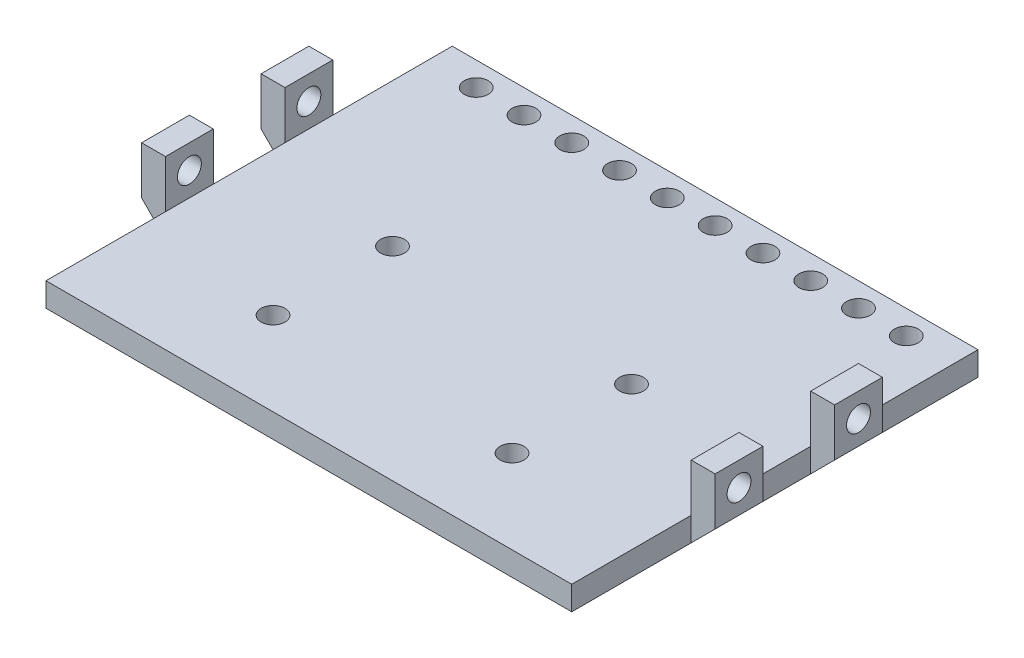
from build123d import *

# Parameters (mm, degrees)
SKETCH1_W           = 120
SKETCH1_H           = 85
BOSS_EXTRUDE1_DEPTH = 5
SKETCH2_W           = 5
SKETCH2_H           = 10
BOSS_EXTRUDE2_DEPTH = 10
SKETCH3_R           = 2.5
CUT_EXTRUDE1_DEPTH  = 129.184437433
SKETCH5_W           = 5
SKETCH5_H           = 25
SKETCH5_H_2         = 15
CUT_EXTRUDE2_DEPTH  = 75.204110398
CHAMFER1_SIZE       = 5
SKETCH6_R           = 2.5
CUT_EXTRUDE3_DEPTH  = 76.041655099
SKETCH7_R           = 2.5
CUT_EXTRUDE4_DEPTH  = 10


with BuildPart() as part:
    # Sketch1 → Boss-Extrude1 (new body)
    with BuildSketch(Plane(origin=(0, 0, 0), x_dir=(1, 0, 0), z_dir=(0, 1, 0))):
        Rectangle(SKETCH1_W, SKETCH1_H)
    extrude(amount=BOSS_EXTRUDE1_DEPTH)

    # Sketch2 → Boss-Extrude2 (add)
    with BuildSketch(Plane(origin=(0, 5, 0), x_dir=(1, 0, 0), z_dir=(0, 1, 0))):
        with Locations((-57.5, 12.5)):
            Rectangle(SKETCH2_W, SKETCH2_H)
        with Locations((-57.5, -12.5)):
            Rectangle(SKETCH2_W, SKETCH2_H)
        with Locations((57.5, -12.5)):
            Rectangle(SKETCH2_W, SKETCH2_H)
        with Locations((57.5, 12.5)):
            Rectangle(SKETCH2_W, SKETCH2_H)
    extrude(amount=BOSS_EXTRUDE2_DEPTH)

    # Sketch3 → Cut-Extrude1 (cut, through all)
    with BuildSketch(Plane.ZY.offset(60)):
        with Locations((-12.5, 10)):
            Circle(SKETCH3_R)
        with Locations((12.5, 10)):
            Circle(SKETCH3_R)
    extrude(amount=-CUT_EXTRUDE1_DEPTH, mode=Mode.SUBTRACT)

    # Sketch5 → Cut-Extrude2 (cut, through all)
    with BuildSketch(Plane(origin=(0, 5, 0), x_dir=(1, 0, 0), z_dir=(0, 1, 0))):
        with Locations((-57.5, 30)):
            Rectangle(SKETCH5_W, SKETCH5_H)
        with Locations((-57.5, 0)):
            Rectangle(SKETCH5_W, SKETCH5_H_2)
        with Locations((-57.5, -30)):
            Rectangle(SKETCH5_W, SKETCH5_H)
        with Locations((57.5, -30)):
            Rectangle(SKETCH5_W, SKETCH5_H)
        with Locations((57.5, 0)):
            Rectangle(SKETCH5_W, SKETCH5_H_2)
        with Locations((57.5, 30)):
            Rectangle(SKETCH5_W, SKETCH5_H)
    extrude(amount=-CUT_EXTRUDE2_DEPTH, mode=Mode.SUBTRACT)

    # Chamfer1
    chamfer1_edges = [part.edges().sort_by_distance(p)[0] for p in [
        (-60, 0, 12.5),
        (-60, 0, -12.5),
        (60, 0, -12.5),
        (60, 0, 12.5),
    ]]
    chamfer(chamfer1_edges, length=CHAMFER1_SIZE)

    # Sketch6 → Cut-Extrude3 (cut, through all)
    with BuildSketch(Plane.XZ):
        with Locations((25, 0)):
            Circle(SKETCH6_R)
        with Locations((-25, 0)):
            Circle(SKETCH6_R)
        with Locations((25, 25)):
            Circle(SKETCH6_R)
        with Locations((-25, 25)):
            Circle(SKETCH6_R)
    extrude(amount=-CUT_EXTRUDE3_DEPTH, mode=Mode.SUBTRACT)

    # Sketch7 → Cut-Extrude4 (cut)
    with BuildSketch(Plane.XZ):
        with Locations((-45, -37.5)):
            Circle(SKETCH7_R)
        with Locations((-35, -37.5)):
            Circle(SKETCH7_R)
        with Locations((-25, -37.5)):
            Circle(SKETCH7_R)
        with Locations((-15, -37.5)):
            Circle(SKETCH7_R)
        with Locations((-5, -37.5)):
            Circle(SKETCH7_R)
        with Locations((5, -37.5)):
            Circle(SKETCH7_R)
        with Locations((15, -37.5)):
            Circle(SKETCH7_R)
        with Locations((25, -37.5)):
            Circle(SKETCH7_R)
        with Locations((35, -37.5)):
            Circle(SKETCH7_R)
        with Locations((45, -37.5)):
            Circle(SKETCH7_R)
    extrude(amount=-CUT_EXTRUDE4_DEPTH, mode=Mode.SUBTRACT)


solid = part.part
